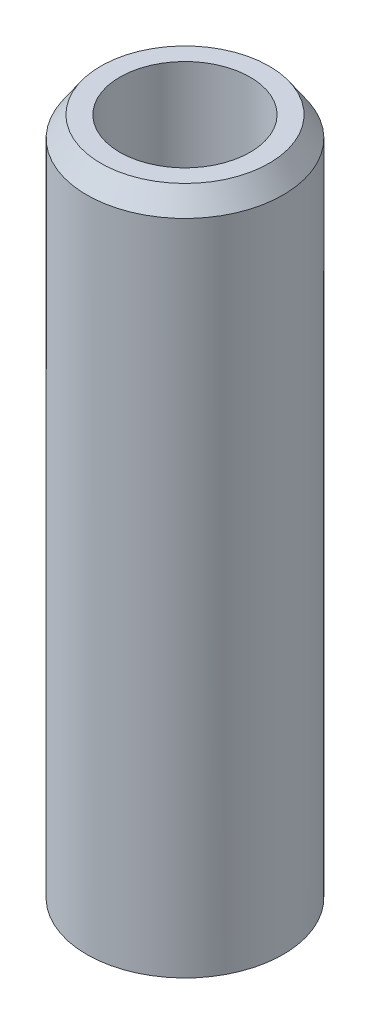
from build123d import *
from OCP.BRepFilletAPI import BRepFilletAPI_MakeChamfer

# Parameters (mm, degrees)
SKETCH1_R           = 22.5
BOSS_EXTRUDE1_DEPTH = 158.595899497
SKETCH2_R           = 14.926833657
CUT_EXTRUDE1_DEPTH  = 162.756481593
CHAMFER1_SIZE       = 4.682070966
CHAMFER1_SIZE2      = 3.205652685


with BuildPart() as part:
    # Sketch1 → Boss-Extrude1 (new body)
    with BuildSketch(Plane(origin=(0, 0, 0), x_dir=(1, 0, 0), z_dir=(0, 1, 0))):
        Circle(SKETCH1_R)
    extrude(amount=BOSS_EXTRUDE1_DEPTH)

    # Sketch2 → Cut-Extrude1 (cut, through all)
    with BuildSketch(Plane(origin=(0, 0, 0), x_dir=(1, 0, 0), z_dir=(0, 1, 0))):
        Circle(SKETCH2_R)
    extrude(amount=CUT_EXTRUDE1_DEPTH, mode=Mode.SUBTRACT)

    # Chamfer1: one chamfer whose edges measure the first distance from different faces: ONE call of the kernel's chamfer builder (chamfer() names one face for all edges)
    chamfer1_edges_1 = [part.edges().sort_by_distance(p)[0] for p in [
        (-22.5, 158.595899497, 0),
    ]]
    chamfer1_side_1 = [part.faces().sort_by_distance(p)[0] for p in [
        (-22.5, 79.297949748, 0),
    ]]
    chamfer1_edges_2 = [part.edges().sort_by_distance(p)[0] for p in [
        (-22.5, 0, 0),
    ]]
    chamfer1_side_2 = [part.faces().sort_by_distance(p)[0] for p in [
        (-21.863603897, 0, 0),
    ]]
    chamfer1 = BRepFilletAPI_MakeChamfer(part.part.solid().wrapped)
    for e in chamfer1_edges_1:
        chamfer1.Add(CHAMFER1_SIZE, CHAMFER1_SIZE2, e.wrapped, chamfer1_side_1[0].wrapped)  # the first distance lies on this face
    for e in chamfer1_edges_2:
        chamfer1.Add(CHAMFER1_SIZE, CHAMFER1_SIZE2, e.wrapped, chamfer1_side_2[0].wrapped)  # the first distance lies on this face
    add(Compound.cast(chamfer1.Shape()), mode=Mode.REPLACE)


solid = part.part
